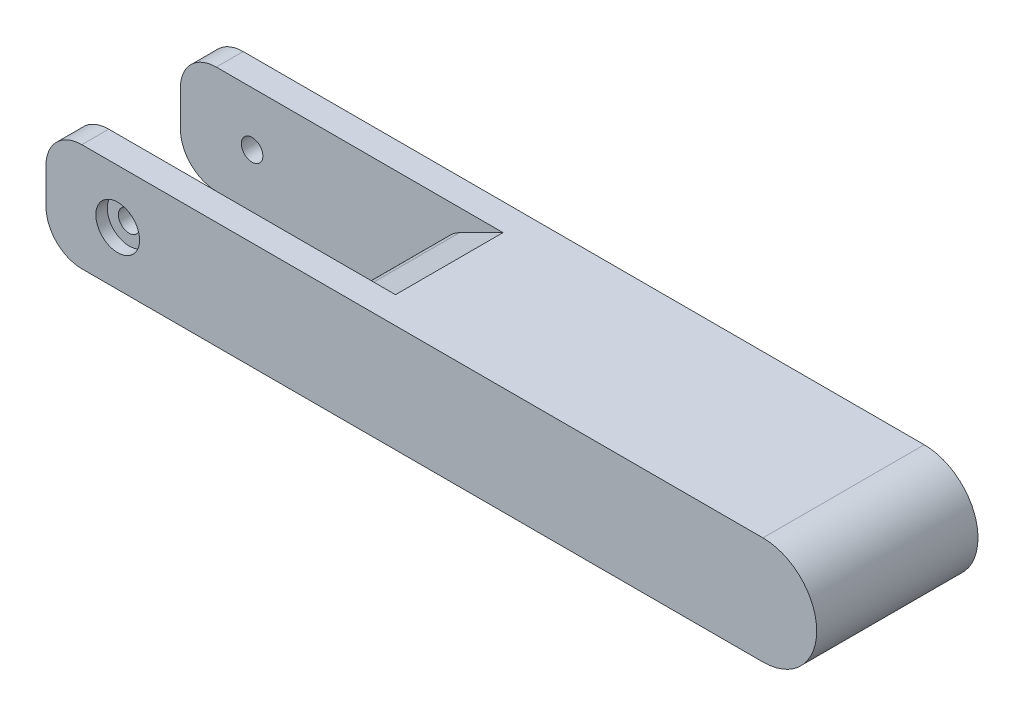
from build123d import *

# Parameters (mm, degrees)
SKETCH1_R           = 3
BOSS_EXTRUDE1_DEPTH = 22.5
SKETCH3_W           = 60
SKETCH3_H           = 30
CUT_EXTRUDE1_DEPTH  = 121.959704034
FILLET1_R           = 10
CUT_EXTRUDE2_DEPTH  = 30
CUT_EXTRUDE4_DEPTH  = 30
FILLET2_R           = 10
SKETCH6_R           = 6.1
CUT_EXTRUDE5_DEPTH  = 3.2
CUT_EXTRUDE6_START  = -3.2
SKETCH7_R           = 6.1
CUT_EXTRUDE6_DEPTH  = 3.2


with BuildPart() as part:
    # Sketch1 → Boss-Extrude1 (new, symmetric)
    with BuildSketch(Plane.XY):
        with BuildLine():
            Line((-100, -15), (100, -15))
            ThreePointArc((100, -15), (115, 0), (100, 15))
            Line((100, 15), (-100, 15))
            Line((-100, 15), (-100, -15))
        make_face()
        with Locations((-80, 0)):
            Circle(SKETCH1_R, mode=Mode.SUBTRACT)
    extrude(amount=BOSS_EXTRUDE1_DEPTH, both=True)

    # Sketch3 → Cut-Extrude1 (cut, through all)
    with BuildSketch(Plane(origin=(0, 15, 0), x_dir=(1, 0, 0), z_dir=(0, 1, 0))):
        with Locations((-70, 0)):
            Rectangle(SKETCH3_W, SKETCH3_H)
    extrude(amount=-CUT_EXTRUDE1_DEPTH, mode=Mode.SUBTRACT)

    # Fillet1
    fillet1_edges = [part.edges().sort_by_distance(p)[0] for p in [
        (-100, -15, 18.75),
        (-100, -15, -18.75),
        (-100, 15, 18.75),
        (-100, 15, -18.75),
    ]]
    fillet(fillet1_edges, radius=FILLET1_R)

    # Sketch4 → Cut-Extrude2 (cut)
    with BuildSketch(Plane(origin=(0, 0, -15), x_dir=(-1, 0, 0), z_dir=(0, 0, -1))):
        Polygon((40, 15), (40, 0), (10, 15), align=None)
    extrude(amount=-CUT_EXTRUDE2_DEPTH, mode=Mode.SUBTRACT)

    # Sketch5 → Cut-Extrude4 (cut)
    with BuildSketch(Plane(origin=(0, 0, -15), x_dir=(-1, 0, 0), z_dir=(0, 0, -1))):
        Polygon((40, 0), (40, -15), (10, -15), align=None)
    extrude(amount=-CUT_EXTRUDE4_DEPTH, mode=Mode.SUBTRACT)

    # Fillet2
    fillet2_edges = [part.edges().sort_by_distance(p)[0] for p in [
        (-40, 0, 0),
    ]]
    fillet(fillet2_edges, radius=FILLET2_R)

    # Sketch6 → Cut-Extrude5 (cut)
    with BuildSketch(Plane.XY.offset(22.5)):
        with Locations((-80, 0)):
            Circle(SKETCH6_R)
    extrude(amount=-CUT_EXTRUDE5_DEPTH, mode=Mode.SUBTRACT)

    # Sketch7 → Cut-Extrude6 (cut)
    with BuildSketch(Plane(origin=(0, 0, -22.5), x_dir=(-1, 0, 0), z_dir=(0, 0, -1)).offset(CUT_EXTRUDE6_START)):
        with Locations((80, 0)):
            Circle(SKETCH7_R)
    extrude(amount=CUT_EXTRUDE6_DEPTH, mode=Mode.SUBTRACT)


solid = part.part
